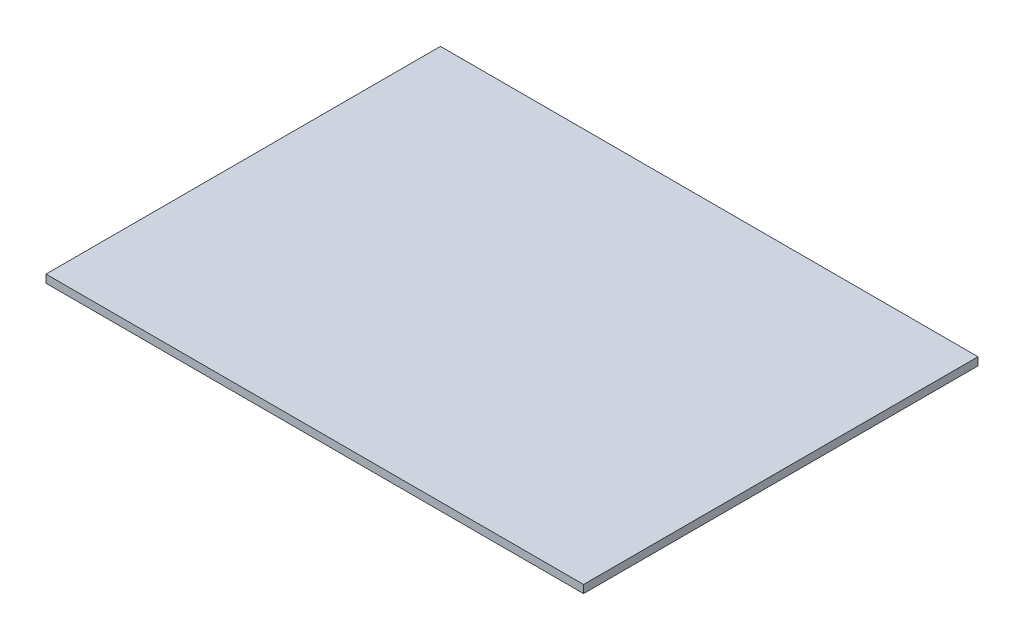
from build123d import *

# Parameters (mm, degrees)
SKETCH1_W           = 338
SKETCH1_H           = 248
BOSS_EXTRUDE1_DEPTH = 5


with BuildPart() as part:
    # Sketch1 → Boss-Extrude1 (new body)
    with BuildSketch(Plane(origin=(0, 0, 0), x_dir=(1, 0, 0), z_dir=(0, 1, 0))):
        Rectangle(SKETCH1_W, SKETCH1_H)
    extrude(amount=BOSS_EXTRUDE1_DEPTH)


solid = part.part
